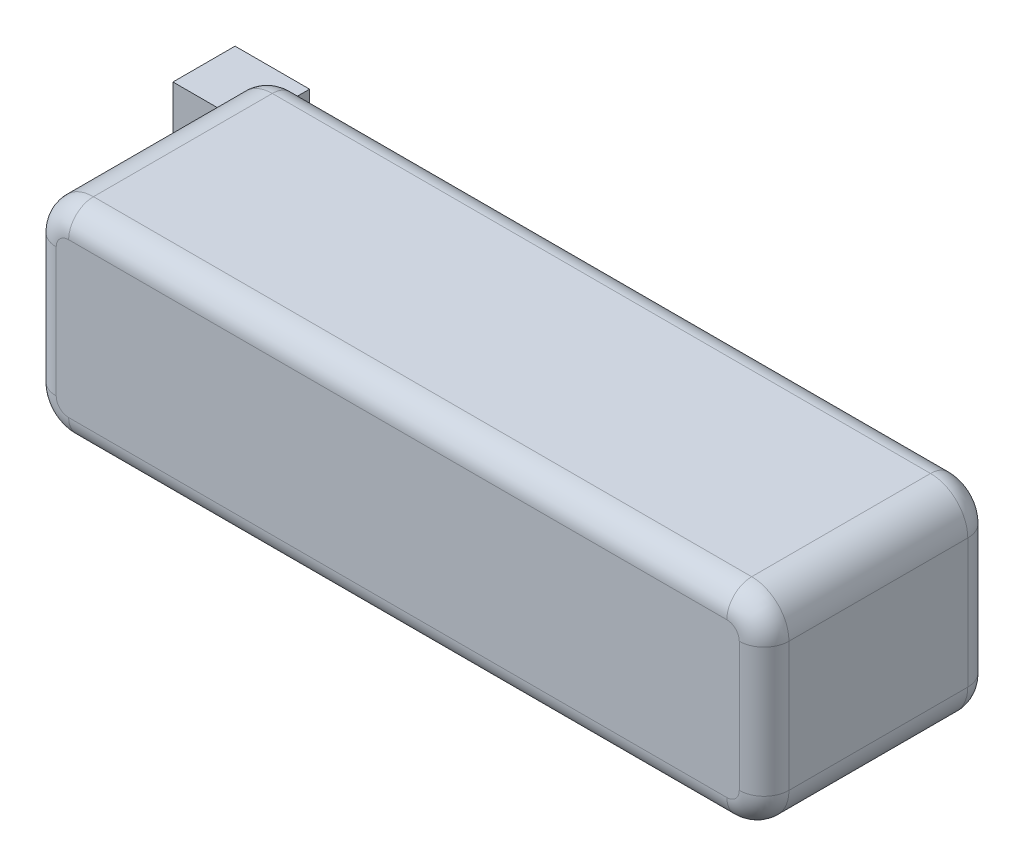
from build123d import *

# Parameters (mm, degrees)
SKETCH1_W           = 74.93
SKETCH1_H           = 23.368
BOSS_EXTRUDE1_DEPTH = 20.828
SKETCH2_W           = 6.35
SKETCH2_H           = 10.16
BOSS_EXTRUDE2_DEPTH = 7.62
FILLET1_R           = 2.54
FILLET2_R           = 3.81
FILLET3_R           = 2.54
FILLET4_R           = 2.54


with BuildPart() as part:
    # Sketch1 → Boss-Extrude1 (new body)
    with BuildSketch(Plane(origin=(0, 0, 0), x_dir=(1, 0, 0), z_dir=(0, 1, 0))):
        with Locations((37.465, -11.684)):
            Rectangle(SKETCH1_W, SKETCH1_H)
    extrude(amount=BOSS_EXTRUDE1_DEPTH)

    # Sketch2 → Boss-Extrude2 (add)
    with BuildSketch(Plane.ZY):
        with Locations((-1.905, 10.414)):
            Rectangle(SKETCH2_W, SKETCH2_H)
    extrude(amount=BOSS_EXTRUDE2_DEPTH)

    # Fillet1
    fillet1_edges = [part.edges().sort_by_distance(p)[0] for p in [
        (0, 10.414, 1.27),
        (0, 10.414, 0),
    ]]
    fillet(fillet1_edges, radius=FILLET1_R)

    # Fillet2
    fillet2_edges = [part.edges().sort_by_distance(p)[0] for p in [
        (0, 20.828, 11.684),
        (74.93, 20.828, 11.684),
        (74.93, 0, 11.684),
        (0, 0, 11.684),
    ]]
    fillet(fillet2_edges, radius=FILLET2_R)

    # Fillet3
    fillet3_edges = [part.edges().sort_by_distance(p)[0] for p in [
        (1.115923164, 1.115923164, 23.368),
        (0, 10.414, 23.368),
        (1.115923164, 19.712076836, 23.368),
        (37.465, 20.828, 23.368),
        (73.814076836, 19.712076836, 23.368),
        (74.93, 10.414, 23.368),
        (73.814076836, 1.115923164, 23.368),
        (37.465, 0, 23.368),
    ]]
    fillet(fillet3_edges, radius=FILLET3_R)

    # Fillet4
    fillet4_edges = [part.edges().sort_by_distance(p)[0] for p in [
        (0, 16.256, 0),
        (1.115923164, 19.712076836, 0),
        (37.465, 20.828, 0),
        (73.814076836, 19.712076836, 0),
        (74.93, 10.414, 0),
        (73.814076836, 1.115923164, 0),
        (0, 4.572, 0),
        (1.115923164, 1.115923164, 0),
        (37.465, 0, 0),
    ]]
    fillet(fillet4_edges, radius=FILLET4_R)


solid = part.part
